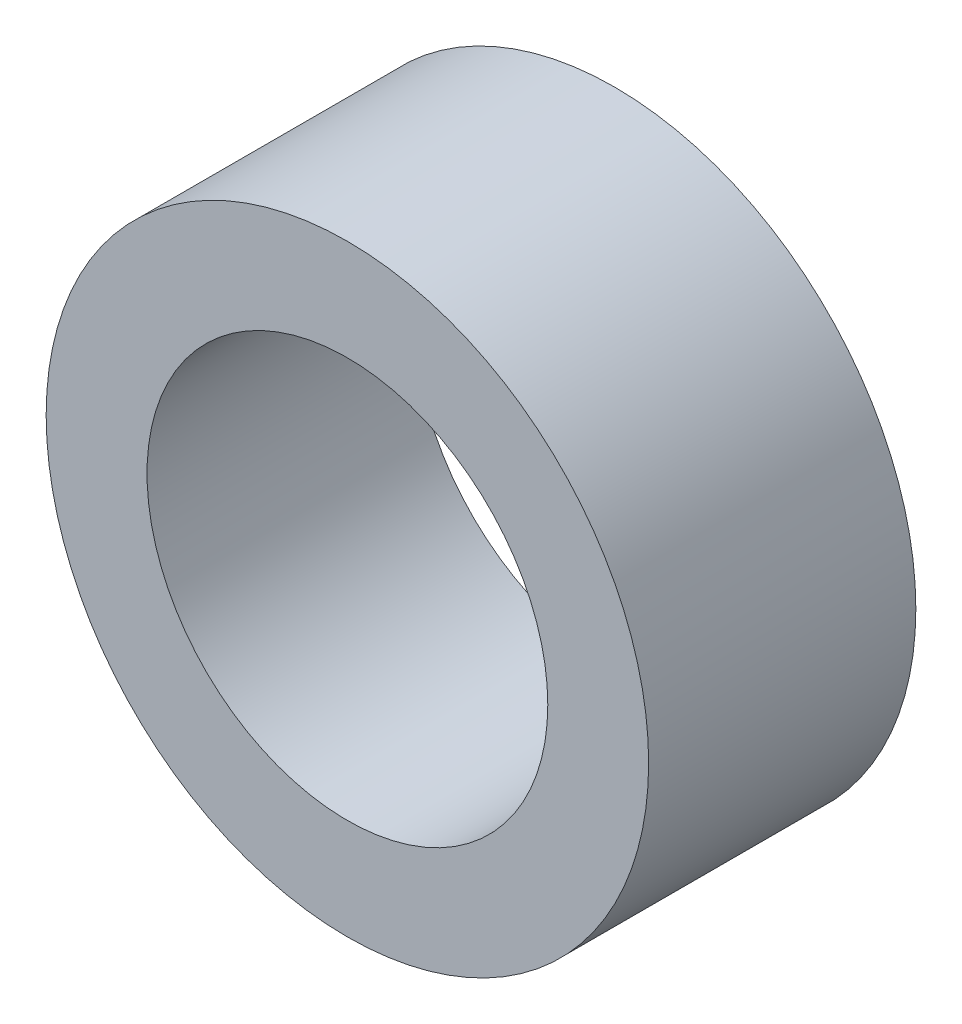
from build123d import *

# Parameters (mm, degrees)
SKETCH1_R      = 4.51
SKETCH1_R_2    = 3
EXTRUDE1_DEPTH = 2


with BuildPart() as part:
    # Sketch1 → Extrude1 (new, symmetric)
    with BuildSketch(Plane.XY):
        Circle(SKETCH1_R)
        Circle(SKETCH1_R_2, mode=Mode.SUBTRACT)
    extrude(amount=EXTRUDE1_DEPTH, both=True)


solid = part.part
